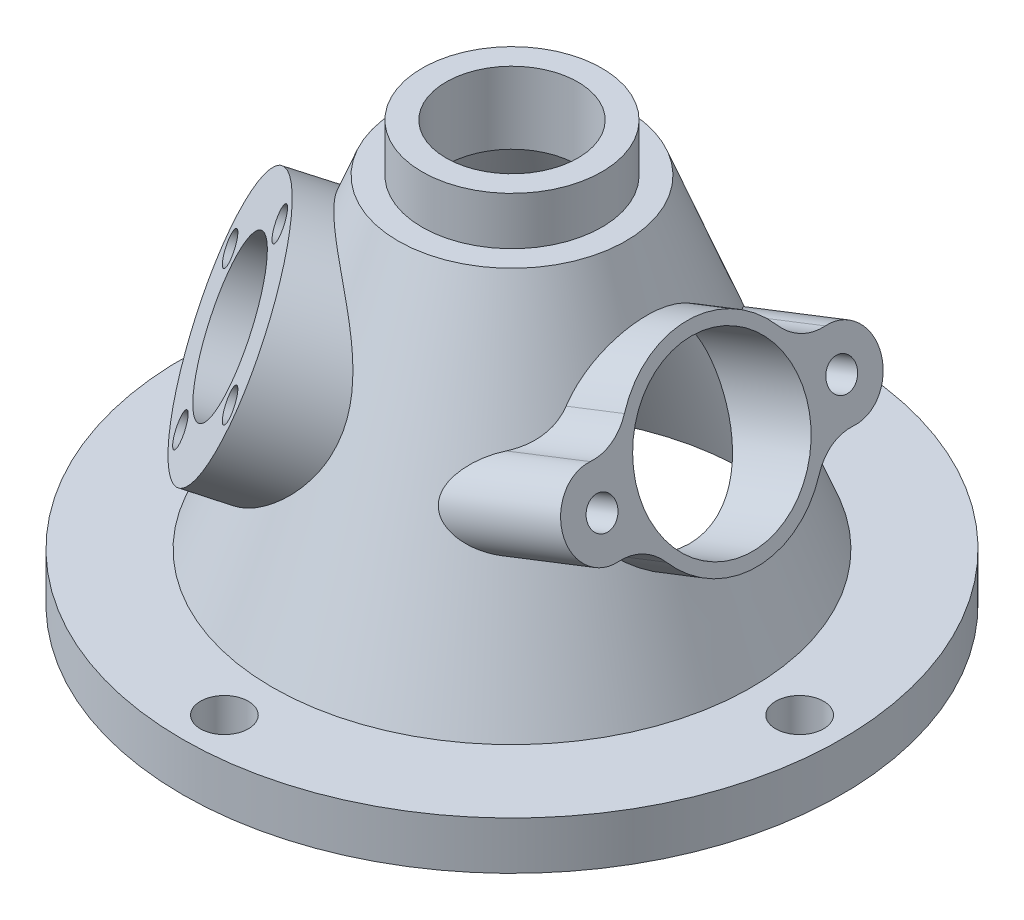
from build123d import *

# Parameters (mm, degrees)
SKETCH2_R           = 2
CUT_EXTRUDE1_DEPTH  = 10
BOSS_EXTRUDE1_REACH = 64.546
SKETCH5_R           = 7
SKETCH5_R_2         = 1.25
SKETCH5_3_R         = 7
SKETCH5_3_R_2       = 1.25
CUT_EXTRUDE2_DEPTH  = 20
BOSS_EXTRUDE2_REACH = 67.765
SKETCH7_R           = 10
SKETCH7_3_R         = 6
SKETCH7_3_R_2       = 1.25
CUT_EXTRUDE3_DEPTH  = 15


with BuildPart() as part:
    # Sketch1 → Revolve1 (revolve)
    with BuildSketch(Plane.XY):
        Polygon((27.5, 0), (27.5, 4), (20, 4), (9.5, 31), (7.5, 31), (7.5, 35), (5.5, 35), (5.5, 29), (8.131865787, 29), (19.409643565, 0), align=None)
    revolve(axis=Axis((0, 0, 0), (0, -1, 0)))

    # Sketch2 → Cut-Extrude1 (cut)
    with BuildSketch(Plane(origin=(0, 4, 0), x_dir=(1, 0, 0), z_dir=(0, 1, 0))):
        with Locations((0, 24)):
            Circle(SKETCH2_R)
        with Locations((24, 0)):
            Circle(SKETCH2_R)
        with Locations((0, -24)):
            Circle(SKETCH2_R)
        with Locations((-24, 0)):
            Circle(SKETCH2_R)
    extrude(amount=-CUT_EXTRUDE1_DEPTH, mode=Mode.SUBTRACT)

    # Sketch5 → Boss-Extrude1 (add, up to next)
    with BuildSketch(Plane(origin=(22.093932973, 8.614064511, 0), x_dir=(0, 0, 1), z_dir=(0.9316912275855487, 0.36325123047297914, 0)), mode=Mode.PRIVATE) as boss_extrude1_sk1:
        with BuildLine():
            ThreePointArc((6.38125, -7.784294165), (0, -4.609192965), (-6.38125, -7.784294165))
            ThreePointArc((-6.38125, -7.784294165), (-7.896554971, -9.004103401), (-9.808081897, -9.364864462))
            ThreePointArc((-9.808081897, -9.364864462), (-13.25, -12.609192965), (-9.808081897, -15.853521469))
            ThreePointArc((-9.808081897, -15.853521469), (-7.896554971, -16.21428253), (-6.38125, -17.434091766))
            ThreePointArc((-6.38125, -17.434091766), (0, -20.609192965), (6.38125, -17.434091766))
            ThreePointArc((6.38125, -17.434091766), (7.896554971, -16.21428253), (9.808081897, -15.853521469))
            ThreePointArc((9.808081897, -15.853521469), (13.25, -12.609192965), (9.808081897, -9.364864462))
            ThreePointArc((9.808081897, -9.364864462), (7.896554971, -9.004103401), (6.38125, -7.784294165))
        make_face()
        with Locations((0, -12.609192965)):
            Circle(SKETCH5_R, mode=Mode.SUBTRACT)
        with Locations((-10, -12.609192965)):
            Circle(SKETCH5_R_2, mode=Mode.SUBTRACT)
        with Locations((10, -12.609192965)):
            Circle(SKETCH5_R_2, mode=Mode.SUBTRACT)
    boss_extrude1_tool1 = extrude(boss_extrude1_sk1.sketch, amount=-BOSS_EXTRUDE1_REACH, mode=Mode.PRIVATE) - part.part
    add(boss_extrude1_tool1.solids().sort_by_distance((20.307191, 13.19682, 0))[0])

    # Sketch5<3> → Cut-Extrude2 (cut)
    with BuildSketch(Plane(origin=(22.093932973, 8.614064511, 0), x_dir=(0, 0, 1), z_dir=(0.9316912275855487, 0.36325123047297914, 0))):
        with Locations((0, -12.609192965)):
            Circle(SKETCH5_3_R)
        with Locations((-10, -12.609192965)):
            Circle(SKETCH5_3_R_2)
        with Locations((10, -12.609192965)):
            Circle(SKETCH5_3_R_2)
    extrude(amount=-CUT_EXTRUDE2_DEPTH, mode=Mode.SUBTRACT)

    # Sketch7 → Boss-Extrude2 (add, up to next)
    with BuildSketch(Plane(origin=(-15.018344857, 8.366322489, 15.018344857), x_dir=(0.7071067811865491, 0, 0.7071067811865459), z_dir=(-0.6579045716551843, 0.36650122672429486, 0.6579045716551873)), mode=Mode.PRIVATE) as boss_extrude2_sk1:
        with Locations((0, 12.564614879)):
            Circle(SKETCH7_R)
    boss_extrude2_tool1 = extrude(boss_extrude2_sk1.sketch, amount=-BOSS_EXTRUDE2_REACH, mode=Mode.PRIVATE) - part.part
    add(boss_extrude2_tool1.solids().sort_by_distance((-11.762156, 20.056661, 11.762156))[0])

    # Sketch7<3> → Cut-Extrude3 (cut)
    with BuildSketch(Plane(origin=(-15.018344857, 8.366322489, 15.018344857), x_dir=(0.7071067811865491, 0, 0.7071067811865459), z_dir=(-0.6579045716551843, 0.36650122672429486, 0.6579045716551873))):
        with Locations((0, 12.564614879)):
            Circle(SKETCH7_3_R)
        with Locations((0, 20.564614879)):
            Circle(SKETCH7_3_R_2)
        with Locations((8, 12.564614879)):
            Circle(SKETCH7_3_R_2)
        with Locations((0, 4.564614879)):
            Circle(SKETCH7_3_R_2)
        with Locations((-8, 12.564614879)):
            Circle(SKETCH7_3_R_2)
    extrude(amount=-CUT_EXTRUDE3_DEPTH, mode=Mode.SUBTRACT)


solid = part.part
